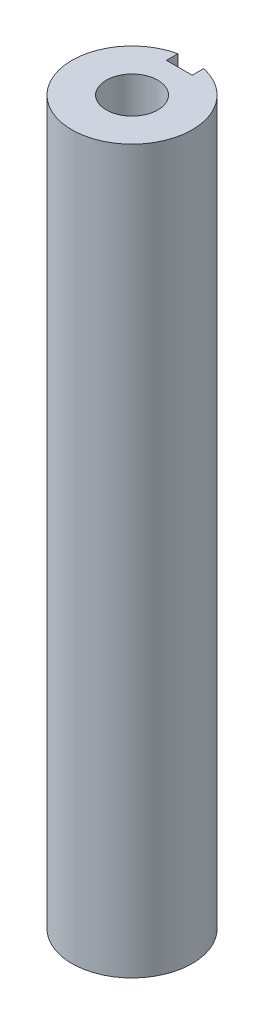
from build123d import *

# Parameters (mm, degrees)
SKETCH1_R   = 4.7625
SHAFT_DEPTH = 133.35


with BuildPart() as part:
    # Sketch1 → Shaft (new body)
    with BuildSketch(Plane(origin=(0, 0, 0), x_dir=(1, 0, 0), z_dir=(0, 1, 0))):
        with BuildLine():
            Line((-2.38125, 10.854368), (-2.38125, 8.73125))
            Line((-2.38125, 8.73125), (2.38125, 8.73125))
            Line((2.38125, 8.73125), (2.38125, 10.854368))
            ThreePointArc((2.38125, 10.854368), (0, -11.1125), (-2.38125, 10.854368))
        make_face()
        Circle(SKETCH1_R, mode=Mode.SUBTRACT)
    extrude(amount=SHAFT_DEPTH)


solid = part.part
